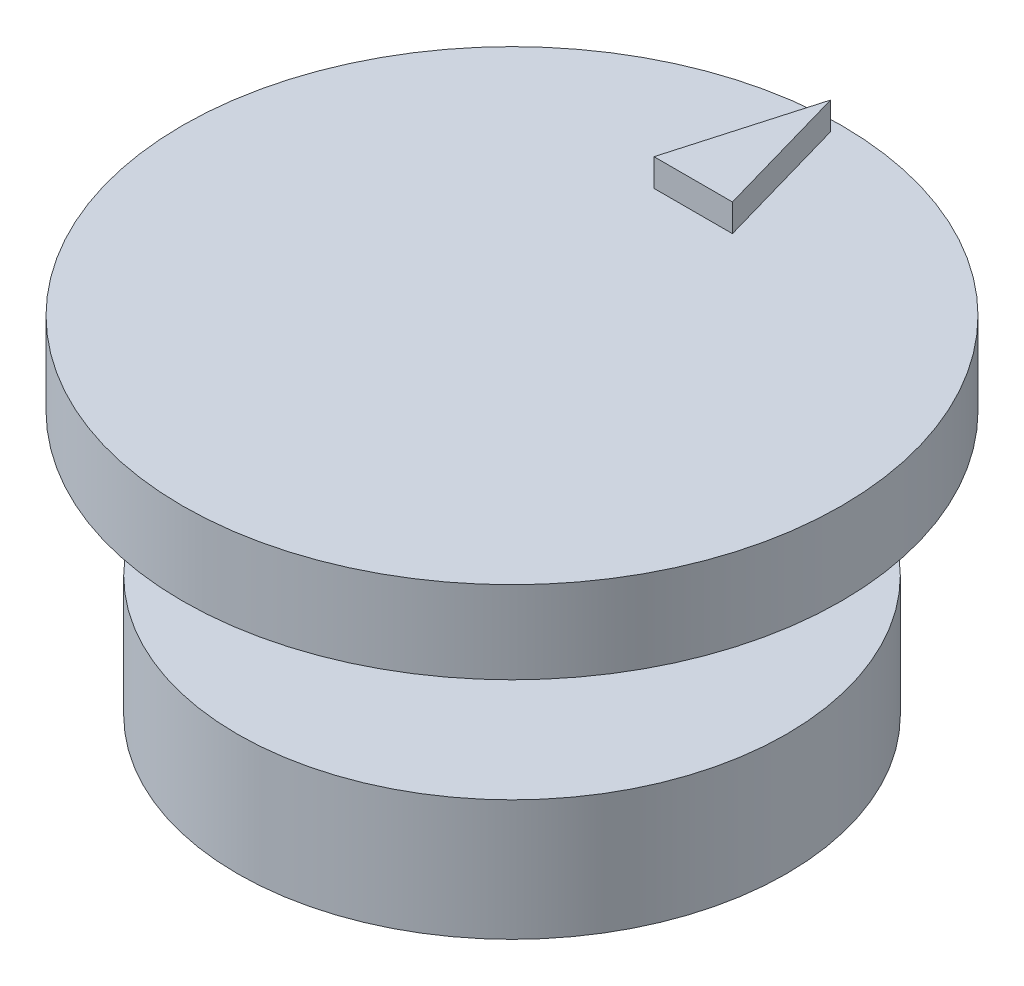
from build123d import *

# Parameters (mm, degrees)
ARROW_DEPTH = 1.27
SKETCH3_R   = 2.286
FLAG_DEPTH  = 6.35


with BuildPart() as part:
    # Sketch1 → dial base shape (revolve)
    with BuildSketch(Plane.XY):
        Polygon((0, -20.891058424), (0, -36.893058424), (12.7, -36.893058424), (12.7, -31.305058424), (3.175, -31.305058424), (3.175, -26.225058424), (12.7, -26.225058424), (12.7, -24.701058424), (15.24, -24.701058424), (15.24, -20.891058424), align=None)
    revolve(axis=Axis((0, -20.891058424, 0), (0, -1, 0)))

    # Sketch2 → arrow (add)
    with BuildSketch(Plane(origin=(0, -20.891058424, 0), x_dir=(1, 0, 0), z_dir=(0, 1, 0))):
        Polygon((0, 14.732), (-1.813922821, 8.382), (1.813922821, 8.382), align=None)
    extrude(amount=ARROW_DEPTH)

    # Sketch3 → flag (add)
    with BuildSketch(Plane.XZ.offset(36.893058424)):
        with Locations((0, -9.854910999)):
            Circle(SKETCH3_R)
    extrude(amount=FLAG_DEPTH)


solid = part.part
